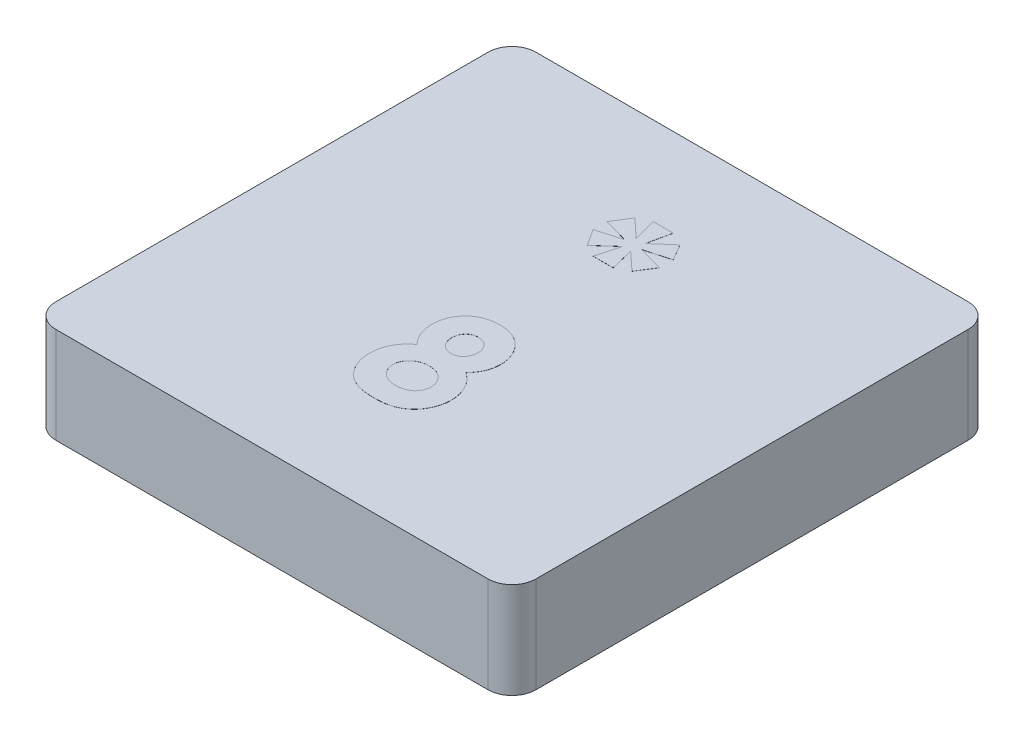
from build123d import *

# Parameters (mm, degrees)
SKETCH1_W           = 12.7
SKETCH1_H           = 12.7
BOSS_EXTRUDE1_DEPTH = 2.54
FILLET1_R           = 0.635
SHELL1_START        = 0.635
SHELL1_OUTLINE_W    = 1.905
SHELL1_OUTLINE_H    = 11.43
SHELL1_DEPTH        = 11.43
SKETCH2_R           = 2.54
BOSS_EXTRUDE2_DEPTH = 1.905
BOSS_EXTRUDE4_DEPTH = 0.00254


# Read off the part's stored shape, not the designer's step: Shell1
with BuildPart() as part:
    # Sketch1 → Boss-Extrude1 (new body)
    with BuildSketch(Plane(origin=(0, 0, 0), x_dir=(1, 0, 0), z_dir=(0, 1, 0))):
        with Locations((6.35, 6.35)):
            Rectangle(SKETCH1_W, SKETCH1_H)
    extrude(amount=BOSS_EXTRUDE1_DEPTH)

    # Fillet1
    fillet1_edges = [part.edges().sort_by_distance(p)[0] for p in [
        (0, 1.27, -12.7),
        (12.7, 1.27, -12.7),
        (12.7, 1.27, 0),
        (0, 1.27, 0),
    ]]
    fillet(fillet1_edges, radius=FILLET1_R)

    # Shell1 outline → Shell1 (cut)
    with BuildSketch(Plane.YZ.offset(SHELL1_START)):
        with Locations((0.9525, -6.35)):
            Rectangle(SHELL1_OUTLINE_W, SHELL1_OUTLINE_H)
    extrude(amount=SHELL1_DEPTH, mode=Mode.SUBTRACT)

    # Sketch2 → Boss-Extrude2 (add)
    with BuildSketch(Plane(origin=(0, 1.905, 0), x_dir=(-1, 0, 0), z_dir=(0, -1, 0))):
        with Locations(Location((-6.35, 6.35, 0), (0, 0, 270))):
            Circle(SKETCH2_R)
    extrude(amount=BOSS_EXTRUDE2_DEPTH)

    # Sketch4 → Boss-Extrude4 (add)
    # profile 1 of 2: a face of its own
    with BuildSketch(Plane(origin=(0, 2.54, 0), x_dir=(1, 0, 0), z_dir=(0, 1, 0))):
        with BuildLine():
            add(Edge.make_bspline(
                [(7.051451122, 4.427415385), (7.084744996, 4.403626012), (7.150647216, 4.356537096), (7.237679941, 4.272175541), (7.31264546, 4.178069248), (7.374756553, 4.074795446), (7.424518087, 3.964892633), (7.460139795, 3.849535537), (7.482766296, 3.729741637), (7.485237785, 3.648182608), (7.486487179, 3.606952644)],
                knots=[0, 0, 0, 0, 1.013736912, 2.006600758, 2.994453809, 3.989973287, 4.987781207, 5.978959008, 6.978317308, 8, 8, 8, 8], degree=3))
            add(Edge.make_bspline(
                [(7.486487179, 3.606952644), (7.48497988, 3.56230785), (7.481990345, 3.473760631), (7.455558858, 3.343906148), (7.413124168, 3.21915344), (7.355128882, 3.100879461), (7.282413461, 2.992759714), (7.197656874, 2.897042926), (7.100752279, 2.816228905), (7.010531357, 2.761397114), (6.932875057, 2.724973392), (6.870207104, 2.701662941), (6.804033866, 2.68114135), (6.733883139, 2.664745961), (6.659767679, 2.651946669), (6.581793257, 2.64349404), (6.499908546, 2.637349495), (6.444066635, 2.636715055), (6.415433494, 2.636389744)],
                knots=[0, 0, 0, 0, 1.313679292, 2.605514271, 3.884962679, 5.186178731, 6.472827995, 7.711026938, 8.938935107, 10.174644318, 10.808706728, 11.462743532, 12.142127587, 12.847854939, 13.582806024, 14.355735269, 15.156897313, 16, 16, 16, 16], degree=3))
            add(Edge.make_bspline(
                [(6.415433494, 2.636389744), (6.384899088, 2.63680393), (6.325271416, 2.637612753), (6.238228295, 2.642503329), (6.156120919, 2.651519654), (6.078777051, 2.663388948), (6.006271106, 2.679095464), (5.938600935, 2.699010467), (5.875603142, 2.721685913), (5.798490535, 2.756211225), (5.710364808, 2.810129893), (5.615116834, 2.889092228), (5.531513482, 2.983138836), (5.458828285, 3.089629843), (5.401535073, 3.207910116), (5.358930133, 3.334267223), (5.333698983, 3.468358751), (5.330661435, 3.560204855), (5.329115385, 3.606952644)],
                knots=[0, 0, 0, 0, 0.886964665, 1.7320671, 2.531131818, 3.285397207, 4.004107883, 4.684213108, 5.332925796, 5.947568694, 7.135706876, 8.320776993, 9.52873045, 10.778999824, 12.05415135, 13.333578234, 14.642845846, 16, 16, 16, 16], degree=3))
            add(Edge.make_bspline(
                [(5.329115385, 3.606952644), (5.330528215, 3.6477324), (5.333304598, 3.727869557), (5.353192206, 3.845295836), (5.38729341, 3.956629844), (5.434085569, 4.062646641), (5.494423265, 4.163358024), (5.568663298, 4.258022955), (5.65586438, 4.347495445), (5.72199059, 4.400333521), (5.755883213, 4.427415385)],
                knots=[0, 0, 0, 0, 1.01821053, 2.000906977, 2.963938143, 3.919209931, 4.888045165, 5.887808425, 6.917407893, 8, 8, 8, 8], degree=3))
            add(Edge.make_bspline(
                [(5.755883213, 4.427415385), (5.734871585, 4.451649224), (5.693506016, 4.499358356), (5.639978563, 4.576142401), (5.594883938, 4.655306832), (5.556596454, 4.736209188), (5.52829337, 4.820242406), (5.506889713, 4.90608531), (5.494783826, 4.994612445), (5.492891639, 5.054282365), (5.491935897, 5.084421595)],
                knots=[0, 0, 0, 0, 1.061529281, 2.089831458, 3.092927091, 4.075998741, 5.048384512, 6.024008542, 7.00192825, 8, 8, 8, 8], degree=3))
            add(Edge.make_bspline(
                [(5.491935897, 5.084421595), (5.493203066, 5.125221227), (5.495703141, 5.205717329), (5.517846158, 5.323421637), (5.554608942, 5.435264189), (5.604621582, 5.540917526), (5.668129862, 5.638079049), (5.743591448, 5.725211214), (5.832067181, 5.799122406), (5.930266887, 5.86254147), (6.038682789, 5.912984406), (6.156286248, 5.948280594), (6.281657185, 5.970624943), (6.368059092, 5.972996971), (6.412253405, 5.974210256)],
                knots=[0, 0, 0, 0, 1.022455555, 2.017265428, 2.990720743, 3.968117071, 4.939886797, 5.893155559, 6.847550415, 7.820889576, 8.817530429, 9.83499769, 10.892607882, 12, 12, 12, 12], degree=3))
            add(Edge.make_bspline(
                [(6.412253405, 5.974210256), (6.455811206, 5.972994985), (6.540739795, 5.970625462), (6.663907506, 5.948429167), (6.778969531, 5.912346749), (6.884974392, 5.860838738), (6.982158522, 5.797297441), (7.069130543, 5.720812731), (7.144355328, 5.631510397), (7.208390768, 5.531835335), (7.259417173, 5.424449897), (7.297140813, 5.311833972), (7.318960613, 5.194872732), (7.322091709, 5.115461569), (7.323666667, 5.075517348)],
                knots=[0, 0, 0, 0, 1.094655142, 2.134348324, 3.136019022, 4.118575226, 5.088726318, 6.048298823, 7.020513804, 8.015920439, 9.020015034, 10.003048569, 10.995523219, 12, 12, 12, 12], degree=3))
            add(Edge.make_bspline(
                [(7.323666667, 5.075517348), (7.322907972, 5.047286932), (7.32141909, 4.991886853), (7.310410597, 4.910266901), (7.291873645, 4.831952447), (7.266028938, 4.755050953), (7.230095972, 4.677472577), (7.181470314, 4.597730777), (7.122323587, 4.512512264), (7.075872707, 4.456738489), (7.051451122, 4.427415385)],
                knots=[0, 0, 0, 0, 0.940746401, 1.846144481, 2.739104268, 3.619506754, 4.545839139, 5.581956076, 6.728711598, 8, 8, 8, 8], degree=3))
        make_face()
        with BuildLine():
            add(Edge.make_bspline(
                [(6.398261018, 5.404338462), (6.374798206, 5.403207337), (6.329157853, 5.401007049), (6.264034414, 5.381147019), (6.205486317, 5.348664527), (6.154850039, 5.303962225), (6.113325651, 5.249722679), (6.082807507, 5.187363237), (6.064709888, 5.117653484), (6.062793903, 5.068841394), (6.061807692, 5.043716466)],
                knots=[0, 0, 0, 0, 1.018099191, 1.980427864, 2.929421084, 3.909248076, 4.895556904, 5.880788387, 6.909183412, 8, 8, 8, 8], degree=3))
            add(Edge.make_bspline(
                [(6.061807692, 5.043716466), (6.063025963, 5.018376967), (6.065404755, 4.968899152), (6.084111282, 4.897850049), (6.115997073, 4.833459356), (6.159776048, 4.777071984), (6.212974592, 4.731016409), (6.272540654, 4.695841724), (6.339134832, 4.675761409), (6.385411394, 4.673038447), (6.409073317, 4.671646154)],
                knots=[0, 0, 0, 0, 1.07118507, 2.091592095, 3.082435519, 4.092579768, 5.090825648, 6.043203473, 6.999459622, 8, 8, 8, 8], degree=3))
            add(Edge.make_bspline(
                [(6.409073317, 4.671646154), (6.433182582, 4.672724942), (6.480151952, 4.674826624), (6.546912406, 4.695427967), (6.607055044, 4.728375617), (6.658558327, 4.774956306), (6.701218867, 4.831364099), (6.732287553, 4.896880076), (6.750169567, 4.970273276), (6.752556879, 5.021568386), (6.753794872, 5.04816859)],
                knots=[0, 0, 0, 0, 1.008803858, 1.965339183, 2.900766489, 3.864508618, 4.855158575, 5.849593072, 6.884859315, 8, 8, 8, 8], degree=3))
            add(Edge.make_bspline(
                [(6.753794872, 5.04816859), (6.752525563, 5.073276908), (6.750070763, 5.121835512), (6.732468912, 5.191549787), (6.700142233, 5.252935947), (6.657669146, 5.306838677), (6.604419279, 5.350307876), (6.542600083, 5.382275387), (6.472666769, 5.400816853), (6.423600022, 5.403139172), (6.398261018, 5.404338462)],
                knots=[0, 0, 0, 0, 1.065910571, 2.061433587, 3.023559535, 3.990682701, 4.956464619, 5.918590567, 6.925120432, 8, 8, 8, 8], degree=3))
        make_face(mode=Mode.SUBTRACT)
        with BuildLine():
            add(Edge.make_bspline(
                [(6.416705529, 4.101774359), (6.398875568, 4.101478266), (6.363732938, 4.10089467), (6.312070383, 4.094164936), (6.262494853, 4.084135968), (6.215067853, 4.070301289), (6.170028982, 4.051441141), (6.12699646, 4.028704884), (6.086118901, 4.001862683), (6.048002635, 3.971401858), (6.013554436, 3.937968201), (5.982502519, 3.90309798), (5.957121961, 3.865889706), (5.935986007, 3.827580194), (5.919003148, 3.787865862), (5.907776196, 3.746092696), (5.900547609, 3.702816998), (5.899510383, 3.673339347), (5.898987179, 3.658470072)],
                knots=[0, 0, 0, 0, 1.129580664, 2.226389355, 3.296443603, 4.333934503, 5.352185725, 6.386189251, 7.41493955, 8.447544828, 9.47401038, 10.455044306, 11.4018853, 12.322125673, 13.225630306, 14.132028716, 15.057747923, 16, 16, 16, 16], degree=3))
            add(Edge.make_bspline(
                [(5.898987179, 3.658470072), (5.899236547, 3.642962887), (5.899731138, 3.612206304), (5.907201235, 3.567314587), (5.917956855, 3.524019609), (5.933063468, 3.482726636), (5.953265691, 3.443459711), (5.977387513, 3.405837072), (6.006270052, 3.370122538), (6.039130166, 3.336507595), (6.075916918, 3.306180917), (6.115564974, 3.279462584), (6.157550675, 3.255906335), (6.203134401, 3.238940191), (6.250628006, 3.223411286), (6.301303857, 3.213990273), (6.354608462, 3.20705803), (6.391027597, 3.206531586), (6.409709335, 3.206261538)],
                knots=[0, 0, 0, 0, 0.973817353, 1.931446211, 2.852767904, 3.776304432, 4.688323523, 5.623710549, 6.581246645, 7.570897993, 8.57436511, 9.572506873, 10.574556662, 11.591826551, 12.624694332, 13.712108235, 14.826391851, 16, 16, 16, 16], degree=3))
            add(Edge.make_bspline(
                [(6.409709335, 3.206261538), (6.428593793, 3.206603842), (6.46539362, 3.207270882), (6.519187568, 3.213166257), (6.570067096, 3.222520502), (6.617971429, 3.235899252), (6.663081721, 3.253037963), (6.704792855, 3.274852151), (6.744057165, 3.299573696), (6.779612888, 3.328455854), (6.812077885, 3.359931378), (6.840051038, 3.394425875), (6.863836299, 3.430830128), (6.883021705, 3.469537483), (6.898502604, 3.510365228), (6.909121529, 3.553720457), (6.915710955, 3.599115958), (6.916310671, 3.630038245), (6.916615385, 3.64574972)],
                knots=[0, 0, 0, 0, 1.200705402, 2.339794563, 3.437264955, 4.487414319, 5.499029866, 6.500076882, 7.476298407, 8.444948224, 9.407950986, 10.347155707, 11.263432813, 12.167927724, 13.089546445, 14.03463663, 15.00140776, 16, 16, 16, 16], degree=3))
            add(Edge.make_bspline(
                [(6.916615385, 3.64574972), (6.916033562, 3.661666599), (6.9148963, 3.692778582), (6.90867337, 3.738722743), (6.896999789, 3.782278525), (6.881727335, 3.824456097), (6.861411464, 3.864382665), (6.836189751, 3.901973963), (6.80748125, 3.938161173), (6.773927355, 3.971333371), (6.737241389, 4.001664551), (6.698195025, 4.028686303), (6.656908531, 4.051571234), (6.613268975, 4.070278529), (6.567116908, 4.084143167), (6.518804472, 4.094164584), (6.468410917, 4.100896176), (6.434112095, 4.10147872), (6.416705529, 4.101774359)],
                knots=[0, 0, 0, 0, 1.011708178, 1.977538892, 2.938094892, 3.871441737, 4.823268678, 5.775953079, 6.743660653, 7.753304209, 8.767430709, 9.76505158, 10.765940967, 11.761741361, 12.775867861, 13.822051386, 14.89469657, 16, 16, 16, 16], degree=3))
        make_face(mode=Mode.SUBTRACT)
    # profile 2 of 2: a face of its own
    with BuildSketch(Plane(origin=(0, 2.54, 0), x_dir=(1, 0, 0), z_dir=(0, 1, 0))):
        Polygon((6.066692308, 10.368410256), (6.595858974, 10.368410256), (6.463567308, 9.757833333), (6.95648097, 10.189689303), (7.206435897, 9.757833333), (6.555153846, 9.574660256), (7.206435897, 9.391487179), (6.924680088, 8.950090946), (6.447030849, 9.391487179), (6.595858974, 8.780910256), (6.066692308, 8.780910256), (6.227604768, 9.391487179), (5.739143229, 8.950090946), (5.456115385, 9.391487179), (6.107397436, 9.574660256), (5.456115385, 9.757833333), (5.739143229, 10.210041867), (6.227604768, 9.757833333), align=None)
    extrude(amount=BOSS_EXTRUDE4_DEPTH)


solid = part.part
